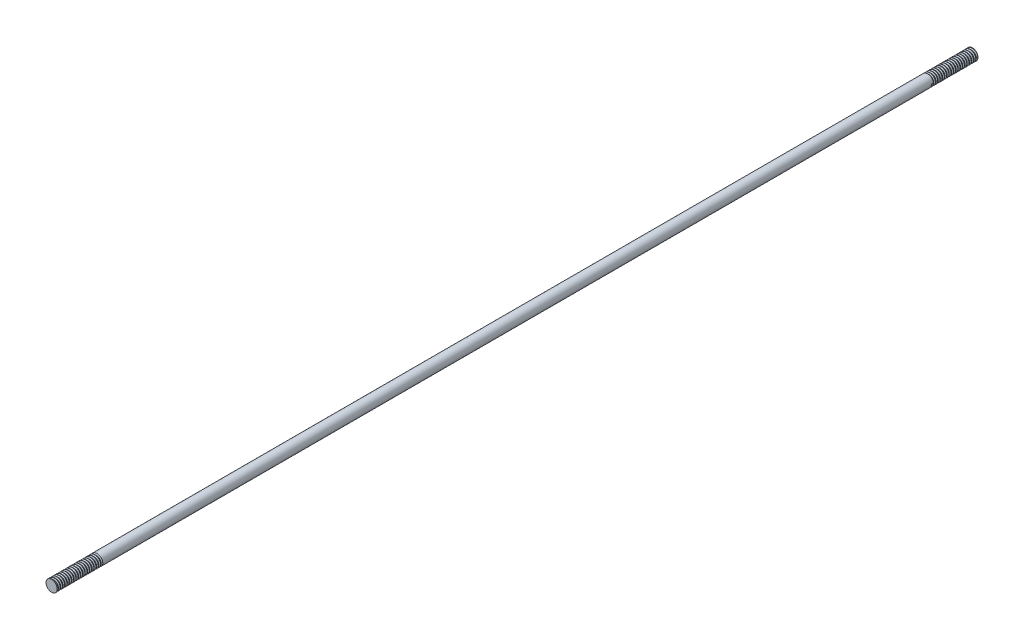
from build123d import *
from build123d.topology import SkipClean

# Parameters (mm, degrees)
SKETCH1_R           = 3.175
BOSS_EXTRUDE1_DEPTH = 522.435
THREAD2_PITCH       = 1.27
THREAD3_PITCH       = 1.27


with BuildPart() as part:
    # Sketch1 → Boss-Extrude1 (new body)
    with BuildSketch(Plane.XY):
        Circle(SKETCH1_R)
    extrude(amount=BOSS_EXTRUDE1_DEPTH)

    # Thread2: the profile of Thread Profile1 profile screwed along a right-hand helix of 20 turns, 8 arcs to a turn; built about Z, then put on its axis
    with SkipClean():  # the faces are left unmerged after this step: merging them gives an invalid solid
        thread2_z = Axis((0, 0, 0), (0, 0, 1))
        thread2_corners = [(3.1753, -1e-09, -0.000173205), (3.1753, -1e-09, 1.111423202), (2.487592339, -1e-09, 0.714374998), (2.487592339, -1e-09, 0.396874998)]
        with BuildLine(mode=Mode.PRIVATE) as thread2_profile:
            Line(thread2_corners[0], thread2_corners[1])
            Line(thread2_corners[1], thread2_corners[2])
            Line(thread2_corners[2], thread2_corners[3])
            Line(thread2_corners[3], thread2_corners[0])
        thread2_cap = Face(thread2_profile.wire())
        thread2_turn_angles = [0, 22.5, 45, 67.5, 90, 112.5, 135, 157.5, 180, 202.5, 225, 247.5, 270, 292.5, 315, 337.5, 360]
        thread2_turn_weights = [1, 0.9238795325112867, 1, 0.9238795325112867, 1, 0.9238795325112867, 1, 0.9238795325112867, 1, 0.9238795325112867, 1, 0.9238795325112867, 1, 0.9238795325112867, 1, 0.9238795325112867, 1]
        thread2_turn_rails = [Edge.make_bspline([Vector(p[0], p[1], 0).rotate(thread2_z, thread2_turn_angles[k]) / thread2_turn_weights[k] + Vector(0, 0, p[2] + THREAD2_PITCH * thread2_turn_angles[k] / 360) for k in range(17)], [0, 0, 0, 1, 1, 2, 2, 3, 3, 4, 4, 5, 5, 6, 6, 7, 7, 8, 8, 8], 2, thread2_turn_weights) for p in thread2_corners]
        thread2_turn_sides = [Face.make_surface_from_curves(thread2_turn_rails[p[0]], thread2_turn_rails[p[1]]) for p in [(0, 1), (1, 2), (2, 3), (3, 0)]]
        thread2 = Plane(origin=(0, 0, 0), x_dir=(0.999390827, 0.034899497, 0), z_dir=(0, 0, 1)) * Solid(Shell([*[p.moved(Location((0, 0, THREAD2_PITCH * i))) for i in range(20) for p in thread2_turn_sides], thread2_cap, thread2_cap.rotate(thread2_z, 7200).moved(Location((0, 0, THREAD2_PITCH * 7200 / 360)))]))
        add(thread2, mode=Mode.SUBTRACT)

    # Thread3: the profile of Thread Profile2 profile screwed along a right-hand helix of 20 turns, 8 arcs to a turn; built about Z, then put on its axis
    with SkipClean():  # the faces are left unmerged after this step: merging them gives an invalid solid
        thread3_z = Axis((0, 0, 0), (0, 0, 1))
        thread3_corners = [(3.1753, -1e-09, -0.000173205), (3.1753, -1e-09, 1.111423202), (2.487592339, -1e-09, 0.714374998), (2.487592339, -1e-09, 0.396874998)]
        with BuildLine(mode=Mode.PRIVATE) as thread3_profile:
            Line(thread3_corners[0], thread3_corners[1])
            Line(thread3_corners[1], thread3_corners[2])
            Line(thread3_corners[2], thread3_corners[3])
            Line(thread3_corners[3], thread3_corners[0])
        thread3_cap = Face(thread3_profile.wire())
        thread3_turn_angles = [0, 22.5, 45, 67.5, 90, 112.5, 135, 157.5, 180, 202.5, 225, 247.5, 270, 292.5, 315, 337.5, 360]
        thread3_turn_weights = [1, 0.9238795325112867, 1, 0.9238795325112867, 1, 0.9238795325112867, 1, 0.9238795325112867, 1, 0.9238795325112867, 1, 0.9238795325112867, 1, 0.9238795325112867, 1, 0.9238795325112867, 1]
        thread3_turn_rails = [Edge.make_bspline([Vector(p[0], p[1], 0).rotate(thread3_z, thread3_turn_angles[k]) / thread3_turn_weights[k] + Vector(0, 0, p[2] + THREAD3_PITCH * thread3_turn_angles[k] / 360) for k in range(17)], [0, 0, 0, 1, 1, 2, 2, 3, 3, 4, 4, 5, 5, 6, 6, 7, 7, 8, 8, 8], 2, thread3_turn_weights) for p in thread3_corners]
        thread3_turn_sides = [Face.make_surface_from_curves(thread3_turn_rails[p[0]], thread3_turn_rails[p[1]]) for p in [(0, 1), (1, 2), (2, 3), (3, 0)]]
        thread3 = Plane(origin=(0, 0, 522.435), x_dir=(-0.999390827, 0.034899497, 0), z_dir=(0, 0, -1)) * Solid(Shell([*[p.moved(Location((0, 0, THREAD3_PITCH * i))) for i in range(20) for p in thread3_turn_sides], thread3_cap, thread3_cap.rotate(thread3_z, 7200).moved(Location((0, 0, THREAD3_PITCH * 7200 / 360)))]))
        add(thread3, mode=Mode.SUBTRACT)


solid = part.part
